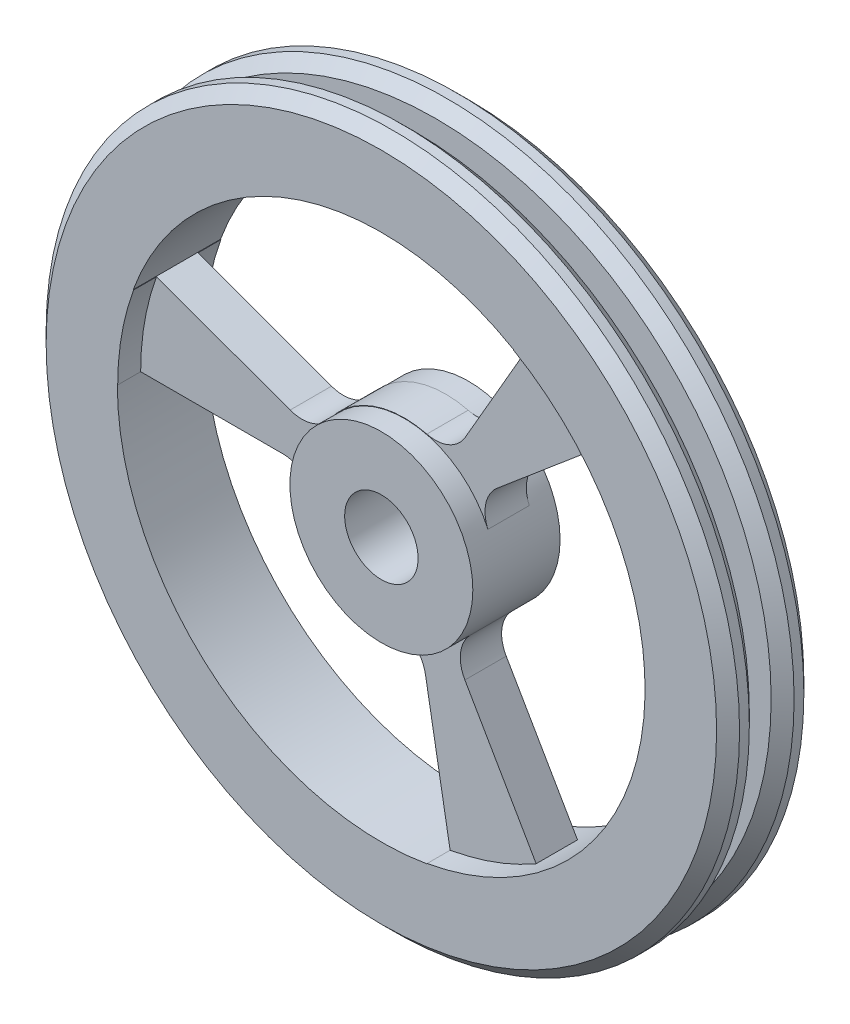
from build123d import *

# Parameters (mm, degrees)
CHAMFER1_SIZE      = 2.54
CUT_EXTRUDE1_DEPTH = 111.185656707
SKETCH6_R          = 58.335249529
SKETCH6_R_2        = 20.235249529
CUT_EXTRUDE2_DEPTH = 5.08
CUT_EXTRUDE3_START = -5.08
SKETCH7_R          = 58.335249529
SKETCH7_R_2        = 20.235249529
CUT_EXTRUDE3_DEPTH = 5.08
FILLET15_R         = 7.62


with BuildPart() as part:
    # Sketch2 → Revolve1 (revolve)
    with BuildSketch(Plane.YZ, mode=Mode.PRIVATE) as revolve1_sk:
        Polygon((8.128, 0), (8.128, 19.304), (76.708, 19.304), (76.708, 12.065), (64.008, 12.065), (64.008, 7.239), (76.708, 7.239), (76.708, 0), align=None)
    revolve(revolve1_sk.sketch.rotate(Axis((0, 0, 0), (0, 0, 1)), 90), axis=Axis((0, 0, 0), (0, 0, 1)))

    # Chamfer1
    chamfer1_edges = [part.edges().sort_by_distance(p)[0] for p in [
        (76.708, 0, 0),
        (76.708, 0, 7.239),
        (76.708, 0, 12.065),
        (76.708, 0, 19.304),
    ]]
    chamfer(chamfer1_edges, length=CHAMFER1_SIZE)

    # Sketch5 → Cut-Extrude1 (cut, through all)
    with BuildSketch(Plane(origin=(0, 0, 0), x_dir=(1, 0, 0), z_dir=(0, 0, -1))):
        with BuildLine():
            Line((-58.42, 0), (-20.32, 0))
            ThreePointArc((-20.32, 0), (-13.061444229, 15.566023084), (3.52853097, 20.011293541))
            Line((3.52853097, 20.011293541), (10.144526539, 57.532468931))
            ThreePointArc((10.144526539, 57.532468931), (-37.551652158, 44.752316367), (-58.42, 0))
        make_face()
        with BuildLine():
            Line((29.21, -50.593204089), (10.16, -17.597636205))
            ThreePointArc((10.16, -17.597636205), (-6.949849312, -19.094554054), (-19.094554054, -6.949849312))
            Line((-19.094554054, -6.949849312), (-54.896842906, -19.980816773))
            ThreePointArc((-54.896842906, -19.980816773), (-19.980816773, -54.896842906), (29.21, -50.593204089))
        make_face()
        with BuildLine():
            Line((15.5725915, -12.921289312), (44.68739374, -37.497175605))
            ThreePointArc((44.68739374, -37.497175605), (57.44900601, 10.129809775), (29.167624765, 50.519808029))
            Line((29.167624765, 50.519808029), (10.117624765, 17.524240144))
            ThreePointArc((10.117624765, 17.524240144), (19.918066395, 3.568746925), (15.5725915, -12.921289312))
        make_face()
    extrude(amount=-CUT_EXTRUDE1_DEPTH, mode=Mode.SUBTRACT)

    # Sketch6 → Cut-Extrude2 (cut)
    with BuildSketch(Plane(origin=(0, 0, 0), x_dir=(1, 0, 0), z_dir=(0, 0, -1))):
        Circle(SKETCH6_R)
        with Locations(Location((0, 0, 0), (0, 0, 60))):
            Circle(SKETCH6_R_2, mode=Mode.SUBTRACT)
    extrude(amount=-CUT_EXTRUDE2_DEPTH, mode=Mode.SUBTRACT)

    # Sketch7 → Cut-Extrude3 (cut)
    with BuildSketch(Plane(origin=(0, 0, 19.304), x_dir=(0, -1, 0), z_dir=(0, 0, 1)).offset(CUT_EXTRUDE3_START)):
        Circle(SKETCH7_R)
        with Locations(Location((0, 0, 0), (0, 0, 90))):
            Circle(SKETCH7_R_2, mode=Mode.SUBTRACT)
    extrude(amount=CUT_EXTRUDE3_DEPTH, mode=Mode.SUBTRACT)

    # Fillet15
    # the kernel refuses this fillet: 7.62 mm, written as the material it adds along each edge
    with BuildSketch(Plane(origin=(10.16, 17.597636205, 5.08), x_dir=(-0.9266160044504649, 0.3760090162433024, 0), z_dir=(0, 0, 1)), Plane(origin=(-20.32, 0, 5.08), x_dir=(0.13767464210654276, -0.9904775075289874, 0), z_dir=(0, 0, 1))) as fillet15_piece_1:
        with BuildLine():
            CenterArc((6.644178228, -7.547438607), FILLET15_R, 97.913310066, 74.173379868)
            Line((-0.903260379, -6.498357835), (0, 0))
            ThreePointArc((0, 0), (2.797548728, -0.193497047), (5.595097455, 0))
        make_face()
    extrude(amount=9.144)
    with BuildSketch(Plane(origin=(-19.094554054, 6.949849312, 5.08), x_dir=(0.4681351043427711, 0.8836569040538205, 0), z_dir=(0, 0, 1)), Plane(origin=(3.52853097, -20.011293541, 5.08), x_dir=(-0.9993368793115024, -0.03641155926279142, 0), z_dir=(0, 0, 1))) as fillet15_piece_2:
        with BuildLine():
            CenterArc((6.644178228, 7.547438607), FILLET15_R, 187.913310066, 74.173379868)
            Line((-0.903260379, 6.498357835), (0, 0))
            ThreePointArc((0, 0), (2.797548728, 0.193497047), (5.595097455, 0))
        make_face()
    extrude(amount=9.144)
    with BuildSketch(Plane(origin=(15.5725915, 12.921289312, 5.08), x_dir=(0.5270307863696181, -0.8498461920951471, 0), z_dir=(0, 0, 1))) as fillet15_piece_3:
        with BuildLine():
            CenterArc((6.592305904, 7.548065724), FILLET15_R, 188.362749939, 73.758264082)
            Line((-0.946671381, 6.439814174), (0, 0))
            ThreePointArc((0, 0), (2.773873375, 0.191024675), (5.54774675, 0))
        make_face()
    extrude(amount=9.144)
    with BuildSketch(Plane(origin=(10.117624765, -17.524240144, 5.08), x_dir=(0.5000000000000031, -0.8660254037844368, 0), z_dir=(0, 0, 1))) as fillet15_piece_4:
        with BuildLine():
            CenterArc((6.557483186, 7.62), FILLET15_R, 195.876042448, 74.123957552)
            ThreePointArc((-0.771857845, 5.535495248), (-0.193893401, 2.794524654), (0, 0))
            Line((0, 0), (6.557483186, 0))
        make_face()
    extrude(amount=9.144)


solid = part.part
